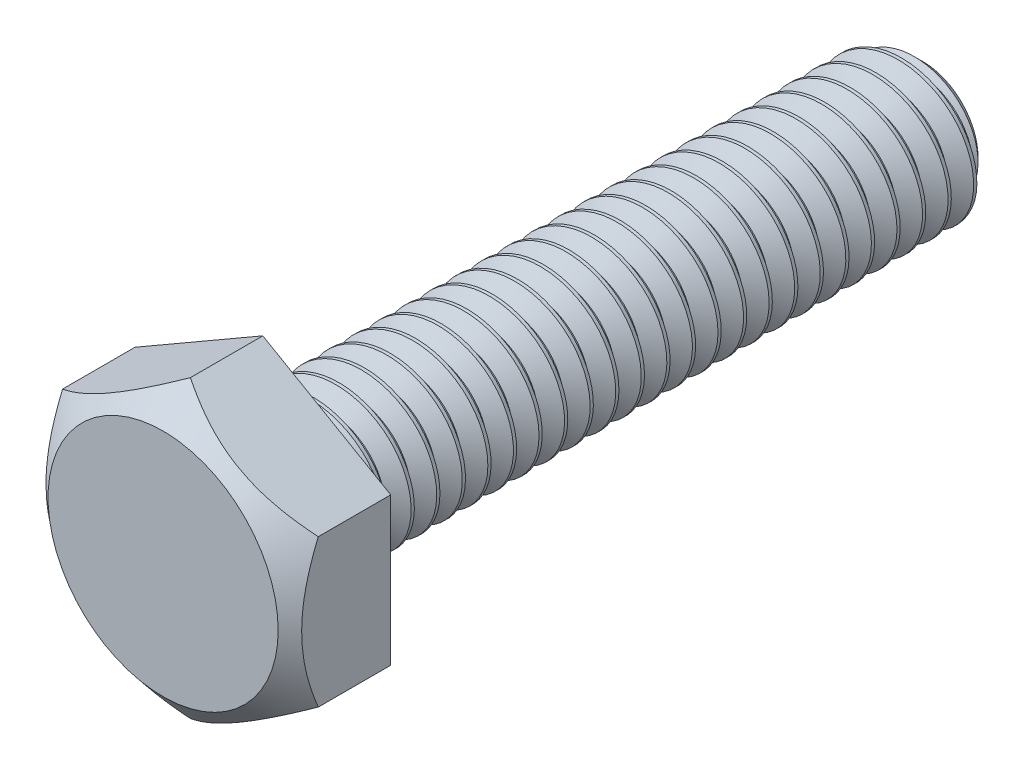
from build123d import *

# Parameters (mm, degrees)
BOSS_EXTRUDE1_DEPTH = 2.8
SKETCH4_OUTSIDE_W   = 67.25
SKETCH4_OUTSIDE_H   = 68.332
SKETCH4_OUTSIDE_R   = 3.15
CUT_EXTRUDE1_DEPTH  = 22.476110759
CUT_EXTRUDE1_DRAFT  = -50
SKETCH9_R           = 4.041451884
SKETCH9_R_2         = 3.325
CUT_EXTRUDE2_DEPTH  = 0.07
CUT_SWEEP1_PITCH    = 0.7
CUT_SWEEP1_TO       = 18
SKETCH8_R           = 2
BOSS_EXTRUDE2_DEPTH = 2.1
BOSS_EXTRUDE2_TAPER = 20


with BuildPart() as part:
    # Sketch2 → Revolve1 (revolve)
    with BuildSketch(Plane(origin=(0, 0, 0), x_dir=(0, 0, -1), z_dir=(1, 0, 0)), mode=Mode.PRIVATE) as revolve1_sk:
        Polygon((18, 0), (0, 0), (0, 2), (17.51, 2), (18, 1.51), align=None)
    revolve(revolve1_sk.sketch.rotate(Axis((0, 0, -18), (0, 0, 1)), 90), axis=Axis((0, 0, -18), (0, 0, 1)))

    # Sketch3 → Boss-Extrude1 (add)
    with BuildSketch(Plane.XY):
        Polygon((0, 4.041451884), (-3.5, 2.020725942), (-3.5, -2.020725942), (0, -4.041451884), (3.5, -2.020725942), (3.5, 2.020725942), align=None)
    extrude(amount=BOSS_EXTRUDE1_DEPTH)


with BuildPart() as cut_extrude1_tool:
    # Sketch4 outside → Cut-Extrude1 (with draft: the straight prism first)
    with BuildSketch(Plane.XY.offset(2.8)):
        Rectangle(SKETCH4_OUTSIDE_W, SKETCH4_OUTSIDE_H)
        Circle(SKETCH4_OUTSIDE_R, mode=Mode.SUBTRACT)
    extrude(amount=-CUT_EXTRUDE1_DEPTH)
    # Cut-Extrude1: the draft: its side faces are tilted about the plane it starts from
    cut_extrude1_sides = [cut_extrude1_tool.faces().sort_by_distance(p)[0] for p in [
        (0, -34.166, -8.43805538),
        (33.625, 0, -8.43805538),
        (0, 34.166, -8.43805538),
        (-33.625, 0, -8.43805538),
        (-3.15, 0, -8.43805538),
    ]]
    draft(cut_extrude1_sides, Plane.XY.offset(2.8), CUT_EXTRUDE1_DRAFT)


with BuildPart() as part_1:
    add(part.part)

    # Cut-Extrude1: cut by cut_extrude1_tool
    add(cut_extrude1_tool.part, mode=Mode.SUBTRACT)

    # Sketch9 → Cut-Extrude2 (cut)
    with BuildSketch(Plane(origin=(0, 0, 0), x_dir=(-1, 0, 0), z_dir=(0, 0, -1))):
        Circle(SKETCH9_R)
        Circle(SKETCH9_R_2, mode=Mode.SUBTRACT)
    extrude(amount=-CUT_EXTRUDE2_DEPTH, mode=Mode.SUBTRACT)


with BuildPart() as body_2:
    # Split1: read off the stored shape, not the designer's step
    # Split1: the piece on the far side of the plane
    add(part_1.part)
    split(bisect_by=Plane.XY, keep=Keep.BOTTOM)

    # Cut-Sweep1: arcs per turn and ends read off the stored shape
    # Cut-Sweep1: the profile of Sketch6 screwed along a right-hand helix through 26.714286 turns, 6 arcs to a turn; built about Z, then put on its axis
    cut_sweep1_z = Axis((0, 0, 0), (0, 0, 1))
    cut_sweep1_corners = [(2.037888611, 0, 0.021875), (2.037888611, 0, -0.634375), (1.545336663, 0, -0.35), (1.545336663, 0, -0.2625)]
    with BuildLine(mode=Mode.PRIVATE) as cut_sweep1_profile:
        Line(cut_sweep1_corners[0], cut_sweep1_corners[1])
        Line(cut_sweep1_corners[1], cut_sweep1_corners[2])
        Line(cut_sweep1_corners[2], cut_sweep1_corners[3])
        Line(cut_sweep1_corners[3], cut_sweep1_corners[0])
    cut_sweep1_cap = Face(cut_sweep1_profile.wire())
    cut_sweep1_turn_angles = [0, 30, 60, 90, 120, 150, 180, 210, 240, 270, 300, 330, 360]
    cut_sweep1_turn_weights = [1, 0.8660254037844387, 1, 0.8660254037844387, 1, 0.8660254037844387, 1, 0.8660254037844387, 1, 0.8660254037844387, 1, 0.8660254037844387, 1]
    cut_sweep1_turn_rails = [Edge.make_bspline([Vector(p[0], p[1], 0).rotate(cut_sweep1_z, cut_sweep1_turn_angles[k]) / cut_sweep1_turn_weights[k] + Vector(0, 0, p[2] + CUT_SWEEP1_PITCH * cut_sweep1_turn_angles[k] / 360) for k in range(13)], [0, 0, 0, 1, 1, 2, 2, 3, 3, 4, 4, 5, 5, 6, 6, 6], 2, cut_sweep1_turn_weights) for p in cut_sweep1_corners]
    cut_sweep1_turn_sides = [Face.make_surface_from_curves(cut_sweep1_turn_rails[p[0]], cut_sweep1_turn_rails[p[1]]) for p in [(0, 1), (1, 2), (2, 3), (3, 0)]]
    cut_sweep1_last_angles = [9360, 9390, 9420, 9450, 9480, 9510, 9540, 9570, 9600, 9608.571428571, 9617.142857143]
    cut_sweep1_last_weights = [1, 0.8660254037844387, 1, 0.8660254037844387, 1, 0.8660254037844387, 1, 0.8660254037844387, 1, 0.9888308262250177, 1]
    cut_sweep1_last_rails = [Edge.make_bspline([Vector(p[0], p[1], 0).rotate(cut_sweep1_z, cut_sweep1_last_angles[k]) / cut_sweep1_last_weights[k] + Vector(0, 0, p[2] + CUT_SWEEP1_PITCH * cut_sweep1_last_angles[k] / 360) for k in range(11)], [0, 0, 0, 1, 1, 2, 2, 3, 3, 4, 4, 5, 5, 5], 2, cut_sweep1_last_weights) for p in cut_sweep1_corners]
    cut_sweep1_last_sides = [Face.make_surface_from_curves(cut_sweep1_last_rails[p[0]], cut_sweep1_last_rails[p[1]]) for p in [(0, 1), (1, 2), (2, 3), (3, 0)]]
    cut_sweep1 = Plane(origin=(0, 0, -18), x_dir=(0, 1, 0), z_dir=(0, 0, 1)) * split(Solid(Shell([*[p.moved(Location((0, 0, CUT_SWEEP1_PITCH * i))) for i in range(26) for p in cut_sweep1_turn_sides], *cut_sweep1_last_sides, cut_sweep1_cap, cut_sweep1_cap.rotate(cut_sweep1_z, 9617.142857143).moved(Location((0, 0, CUT_SWEEP1_PITCH * 9617.142857143 / 360)))])), bisect_by=Plane.XY.offset(CUT_SWEEP1_TO), keep=Keep.BOTTOM, mode=Mode.PRIVATE)
    add(cut_sweep1, mode=Mode.SUBTRACT)


with BuildPart() as part_2:
    add(part_1.part)

    # Split1
    split(bisect_by=Plane.XY, keep=Keep.TOP)

    add(body_2.part)  # Boss-Extrude2 merges body 2
    # Sketch8 → Boss-Extrude2 (add)
    with BuildSketch(Plane(origin=(0, 0, 0), x_dir=(-1, 0, 0), z_dir=(0, 0, -1))):
        Circle(SKETCH8_R)
    extrude(amount=BOSS_EXTRUDE2_DEPTH, taper=BOSS_EXTRUDE2_TAPER)


solid = part_2.part
